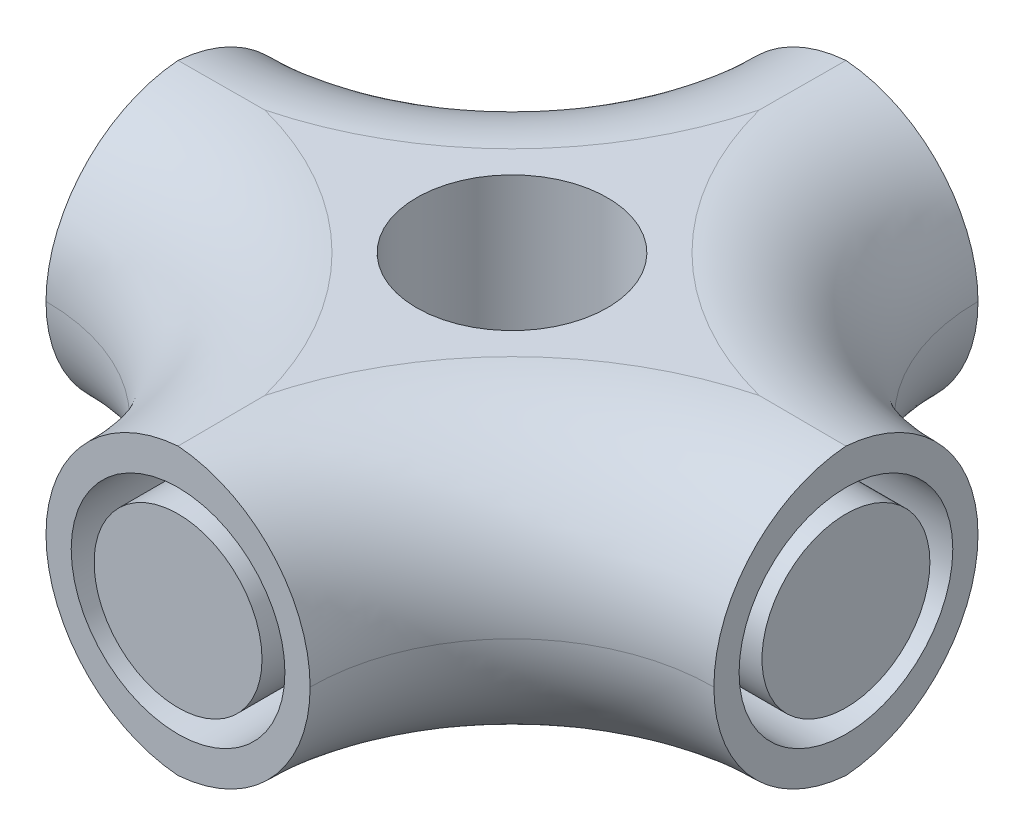
from build123d import *

# Parameters (mm, degrees)
SKETCH3_W                   = 35
SKETCH3_H                   = 35
SKETCH3_R                   = 5
Y_KSEKLIK_EKSTR_ZYON1_DEPTH = 15
IZIM1_R                     = 5.6
IZIM1_R_2                   = 4.4
KES_EKSTR_ZYON2_DEPTH       = 10
DAIRESEL_KAPLAMA1_COUNT     = 4
KES_EKSTR_ZYON3_DEPTH       = 29.939592257
DAIRESEL_KAPLAMA3_COUNT     = 4
RADYUS3_R                   = 7.5
IZIM4_R                     = 5
IZIM4_R_2                   = 2.5
Y_KSEKLIK_EKSTR_ZYON2_DEPTH = 3


with BuildPart() as part:
    # Sketch3 → Yükseklik-Ekstrüzyon1 (new body)
    with BuildSketch(Plane(origin=(0, 0, 0), x_dir=(1, 0, 0), z_dir=(0, 1, 0))):
        Rectangle(SKETCH3_W, SKETCH3_H)
        with Locations(Location((0, 0, 0), (0, 0, 270))):
            Circle(SKETCH3_R, mode=Mode.SUBTRACT)
    extrude(amount=Y_KSEKLIK_EKSTR_ZYON1_DEPTH)

    # Çizim1 → Kes-Ekstrüzyon2 (cut)
    with BuildSketch(Plane.XY.offset(17.5)):
        with Locations((0, 7.5)):
            Circle(IZIM1_R)
        with Locations((0, 7.5)):
            Circle(IZIM1_R_2, mode=Mode.SUBTRACT)
    kes_ekstr_zyon2 = extrude(amount=-KES_EKSTR_ZYON2_DEPTH, mode=Mode.SUBTRACT)

    # Dairesel Kaplama1: Kes-Ekstrüzyon2 ×4 about axis
    dairesel_kaplama1_axis = Axis((0, 0, 0), (0, 1, 0))
    for i in range(1, DAIRESEL_KAPLAMA1_COUNT):
        add(kes_ekstr_zyon2.rotate(dairesel_kaplama1_axis, i * 360 / DAIRESEL_KAPLAMA1_COUNT), mode=Mode.SUBTRACT)

    # Çizim3 → Kes-Ekstrüzyon3 (cut, through all)
    with BuildSketch(Plane(origin=(0, 15, 0), x_dir=(1, 0, 0), z_dir=(0, 1, 0))):
        with BuildLine():
            ThreePointArc((-6.920403545, -17.5), (-10.019095604, -10.019095604), (-17.5, -6.920403545))
            Line((-17.5, -6.920403545), (-17.5, -17.5))
            Line((-17.5, -17.5), (-6.920403545, -17.5))
        make_face()
    kes_ekstr_zyon3 = extrude(amount=-KES_EKSTR_ZYON3_DEPTH, mode=Mode.SUBTRACT)

    # Dairesel Kaplama3: Kes-Ekstrüzyon3 ×4 about axis
    dairesel_kaplama3_axis = Axis((0, 0, 0), (0, 1, 0))
    for i in range(1, DAIRESEL_KAPLAMA3_COUNT):
        add(kes_ekstr_zyon3.rotate(dairesel_kaplama3_axis, i * 360 / DAIRESEL_KAPLAMA3_COUNT), mode=Mode.SUBTRACT)

    # Radyus3
    # the kernel refuses this fillet: 7.5 mm, written as the material it takes off along each edge
    with BuildSketch(Plane(origin=(-17.5, 15, 17.5), x_dir=(1, 0, 0), z_dir=(0, 0, 1))) as radyus3_piece_1:
        with BuildLine():
            CenterArc((10.579596455 + RADYUS3_R, -RADYUS3_R), RADYUS3_R, 90, 90)
            Line((10.579596455, -RADYUS3_R), (10.579596455 - RADYUS3_R * 0.02, -RADYUS3_R))
            Line((10.579596455 - RADYUS3_R * 0.02, -RADYUS3_R), (10.579596455 - RADYUS3_R * 0.02, RADYUS3_R * 0.02))
            Line((10.579596455 - RADYUS3_R * 0.02, RADYUS3_R * 0.02), (10.579596455 + RADYUS3_R, RADYUS3_R * 0.02))
            Line((10.579596455 + RADYUS3_R, RADYUS3_R * 0.02), (10.579596455 + RADYUS3_R, 0))
        make_face()
    radyus3_piece_1_solid = revolve(axis=Axis((-17.5, 15, 17.5), (0, 1, 0)), revolution_arc=90, mode=Mode.PRIVATE)
    with BuildSketch(Plane(origin=(-17.5, 0, 17.5), x_dir=(1, 0, 0), z_dir=(0, 0, 1))) as radyus3_piece_2:
        with BuildLine():
            CenterArc((10.579596455 + RADYUS3_R, RADYUS3_R), RADYUS3_R, 180, 90)
            Line((10.579596455, RADYUS3_R), (10.579596455 - RADYUS3_R * 0.02, RADYUS3_R))
            Line((10.579596455 - RADYUS3_R * 0.02, RADYUS3_R), (10.579596455 - RADYUS3_R * 0.02, -RADYUS3_R * 0.02))
            Line((10.579596455 - RADYUS3_R * 0.02, -RADYUS3_R * 0.02), (10.579596455 + RADYUS3_R, -RADYUS3_R * 0.02))
            Line((10.579596455 + RADYUS3_R, -RADYUS3_R * 0.02), (10.579596455 + RADYUS3_R, 0))
        make_face()
    radyus3_piece_2_solid = revolve(axis=Axis((-17.5, 0, 17.5), (0, 1, 0)), revolution_arc=90, mode=Mode.PRIVATE)
    with BuildSketch(Plane(origin=(-17.5, 15, -17.5), x_dir=(0, 0, 1), z_dir=(-1, 0, 0))) as radyus3_piece_3:
        with BuildLine():
            CenterArc((10.579596455 + RADYUS3_R, -RADYUS3_R), RADYUS3_R, 90, 90)
            Line((10.579596455, -RADYUS3_R), (10.579596455 - RADYUS3_R * 0.02, -RADYUS3_R))
            Line((10.579596455 - RADYUS3_R * 0.02, -RADYUS3_R), (10.579596455 - RADYUS3_R * 0.02, RADYUS3_R * 0.02))
            Line((10.579596455 - RADYUS3_R * 0.02, RADYUS3_R * 0.02), (10.579596455 + RADYUS3_R, RADYUS3_R * 0.02))
            Line((10.579596455 + RADYUS3_R, RADYUS3_R * 0.02), (10.579596455 + RADYUS3_R, 0))
        make_face()
    radyus3_piece_3_solid = revolve(axis=Axis((-17.5, 15, -17.5), (0, 1, 0)), revolution_arc=90, mode=Mode.PRIVATE)
    with BuildSketch(Plane(origin=(17.5, 15, -17.5), x_dir=(-1, 0, 0), z_dir=(0, 0, -1))) as radyus3_piece_4:
        with BuildLine():
            CenterArc((10.579596455 + RADYUS3_R, -RADYUS3_R), RADYUS3_R, 90, 90)
            Line((10.579596455 + RADYUS3_R, 0), (10.579596455 + RADYUS3_R, RADYUS3_R * 0.02))
            Line((10.579596455 + RADYUS3_R, RADYUS3_R * 0.02), (10.579596455 - RADYUS3_R * 0.02, RADYUS3_R * 0.02))
            Line((10.579596455 - RADYUS3_R * 0.02, RADYUS3_R * 0.02), (10.579596455 - RADYUS3_R * 0.02, -RADYUS3_R))
            Line((10.579596455 - RADYUS3_R * 0.02, -RADYUS3_R), (10.579596455, -RADYUS3_R))
        make_face()
    radyus3_piece_4_solid = revolve(axis=Axis((17.5, 15, -17.5), (0, 1, 0)), revolution_arc=90, mode=Mode.PRIVATE)
    with BuildSketch(Plane(origin=(17.5, 15, 17.5), x_dir=(0, 0, -1), z_dir=(1, 0, 0))) as radyus3_piece_5:
        with BuildLine():
            CenterArc((10.579596455 + RADYUS3_R, -RADYUS3_R), RADYUS3_R, 90, 90)
            Line((10.579596455, -RADYUS3_R), (10.579596455 - RADYUS3_R * 0.02, -RADYUS3_R))
            Line((10.579596455 - RADYUS3_R * 0.02, -RADYUS3_R), (10.579596455 - RADYUS3_R * 0.02, RADYUS3_R * 0.02))
            Line((10.579596455 - RADYUS3_R * 0.02, RADYUS3_R * 0.02), (10.579596455 + RADYUS3_R, RADYUS3_R * 0.02))
            Line((10.579596455 + RADYUS3_R, RADYUS3_R * 0.02), (10.579596455 + RADYUS3_R, 0))
        make_face()
    radyus3_piece_5_solid = revolve(axis=Axis((17.5, 15, 17.5), (0, 1, 0)), revolution_arc=90, mode=Mode.PRIVATE)
    with BuildSketch(Plane(origin=(17.5, 0, 17.5), x_dir=(0, 0, -1), z_dir=(1, 0, 0))) as radyus3_piece_6:
        with BuildLine():
            CenterArc((10.579596455 + RADYUS3_R, RADYUS3_R), RADYUS3_R, 180, 90)
            Line((10.579596455, RADYUS3_R), (10.579596455 - RADYUS3_R * 0.02, RADYUS3_R))
            Line((10.579596455 - RADYUS3_R * 0.02, RADYUS3_R), (10.579596455 - RADYUS3_R * 0.02, -RADYUS3_R * 0.02))
            Line((10.579596455 - RADYUS3_R * 0.02, -RADYUS3_R * 0.02), (10.579596455 + RADYUS3_R, -RADYUS3_R * 0.02))
            Line((10.579596455 + RADYUS3_R, -RADYUS3_R * 0.02), (10.579596455 + RADYUS3_R, 0))
        make_face()
    radyus3_piece_6_solid = revolve(axis=Axis((17.5, 0, 17.5), (0, 1, 0)), revolution_arc=90, mode=Mode.PRIVATE)
    with BuildSketch(Plane(origin=(17.5, 0, -17.5), x_dir=(-1, 0, 0), z_dir=(0, 0, -1))) as radyus3_piece_7:
        with BuildLine():
            CenterArc((10.579596455 + RADYUS3_R, RADYUS3_R), RADYUS3_R, 180, 90)
            Line((10.579596455, RADYUS3_R), (10.579596455 - RADYUS3_R * 0.02, RADYUS3_R))
            Line((10.579596455 - RADYUS3_R * 0.02, RADYUS3_R), (10.579596455 - RADYUS3_R * 0.02, -RADYUS3_R * 0.02))
            Line((10.579596455 - RADYUS3_R * 0.02, -RADYUS3_R * 0.02), (10.579596455 + RADYUS3_R, -RADYUS3_R * 0.02))
            Line((10.579596455 + RADYUS3_R, -RADYUS3_R * 0.02), (10.579596455 + RADYUS3_R, 0))
        make_face()
    radyus3_piece_7_solid = revolve(axis=Axis((17.5, 0, -17.5), (0, 1, 0)), revolution_arc=90, mode=Mode.PRIVATE)
    with BuildSketch(Plane(origin=(-17.5, 0, -17.5), x_dir=(0, 0, 1), z_dir=(-1, 0, 0))) as radyus3_piece_8:
        with BuildLine():
            CenterArc((10.579596455 + RADYUS3_R, RADYUS3_R), RADYUS3_R, 180, 90)
            Line((10.579596455, RADYUS3_R), (10.579596455 - RADYUS3_R * 0.02, RADYUS3_R))
            Line((10.579596455 - RADYUS3_R * 0.02, RADYUS3_R), (10.579596455 - RADYUS3_R * 0.02, -RADYUS3_R * 0.02))
            Line((10.579596455 - RADYUS3_R * 0.02, -RADYUS3_R * 0.02), (10.579596455 + RADYUS3_R, -RADYUS3_R * 0.02))
            Line((10.579596455 + RADYUS3_R, -RADYUS3_R * 0.02), (10.579596455 + RADYUS3_R, 0))
        make_face()
    radyus3_piece_8_solid = revolve(axis=Axis((-17.5, 0, -17.5), (0, 1, 0)), revolution_arc=90, mode=Mode.PRIVATE)
    add([radyus3_piece_1_solid, radyus3_piece_2_solid, radyus3_piece_3_solid, radyus3_piece_4_solid, radyus3_piece_5_solid, radyus3_piece_6_solid, radyus3_piece_7_solid, radyus3_piece_8_solid], mode=Mode.SUBTRACT)

    # Çizim4 → Yükseklik-Ekstrüzyon2 (add)
    with BuildSketch(Plane(origin=(0, 0, 0), x_dir=(1, 0, 0), z_dir=(0, 1, 0))):
        with Locations(Location((0, 0, 0), (0, 0, 270))):
            Circle(IZIM4_R)
        with Locations(Location((0, 0, 0), (0, 0, 270))):
            Circle(IZIM4_R_2, mode=Mode.SUBTRACT)
    extrude(amount=Y_KSEKLIK_EKSTR_ZYON2_DEPTH)


solid = part.part
